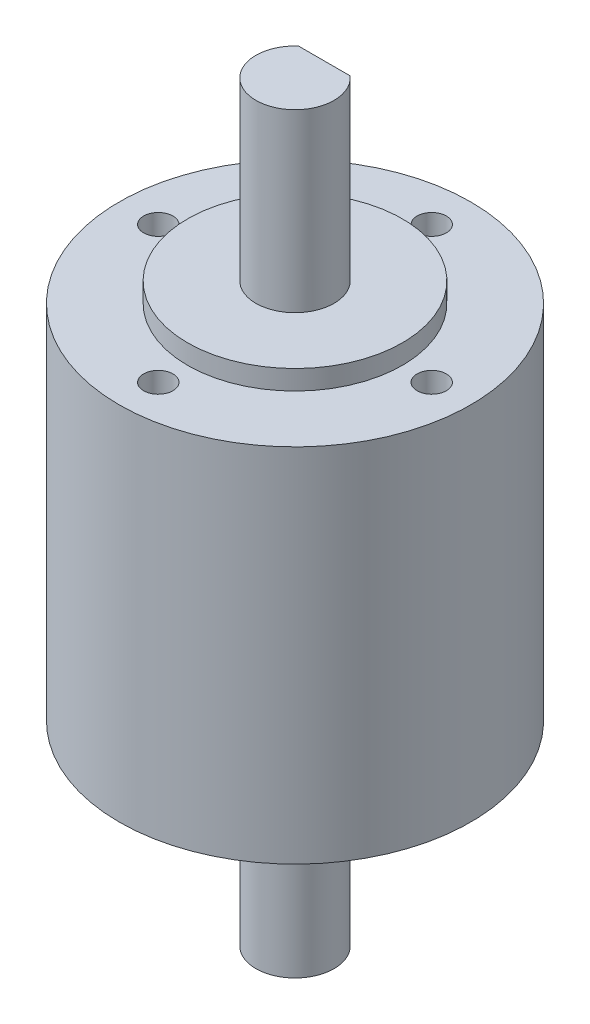
from build123d import *

# Parameters (mm, degrees)
SKETCH1_R           = 18
BOSS_EXTRUDE1_DEPTH = 18.5
SKETCH2_R           = 11
BOSS_EXTRUDE2_DEPTH = 2
SKETCH3_R           = 4
BOSS_EXTRUDE4_DEPTH = 18
CUT_EXTRUDE1_START  = -15
CUT_EXTRUDE1_DEPTH  = 15
SKETCH5_R           = 1.5
CUT_EXTRUDE2_DEPTH  = 4


with BuildPart() as part:
    # Sketch1 → Boss-Extrude1 (new, symmetric)
    with BuildSketch(Plane(origin=(0, 0, 0), x_dir=(1, 0, 0), z_dir=(0, 1, 0))):
        Circle(SKETCH1_R)
    extrude(amount=BOSS_EXTRUDE1_DEPTH, both=True)

    # Sketch2 → Boss-Extrude2 (add)
    with BuildSketch(Plane(origin=(0, 18.5, 0), x_dir=(1, 0, 0), z_dir=(0, 1, 0))):
        Circle(SKETCH2_R)
    boss_extrude2 = extrude(amount=BOSS_EXTRUDE2_DEPTH)

    # Sketch3 → Boss-Extrude4 (add)
    with BuildSketch(Plane(origin=(0, 20.5, 0), x_dir=(1, 0, 0), z_dir=(0, 1, 0))):
        Circle(SKETCH3_R)
    boss_extrude4 = extrude(amount=BOSS_EXTRUDE4_DEPTH)

    # Sketch4 → Cut-Extrude1 (cut)
    with BuildSketch(Plane(origin=(0, 38.5, 0), x_dir=(1, 0, 0), z_dir=(0, 1, 0)).offset(CUT_EXTRUDE1_START)):
        with BuildLine():
            Line((-2.645751311, 3), (2.645751311, 3))
            ThreePointArc((2.645751311, 3), (0, 4), (-2.645751311, 3))
        make_face()
    cut_extrude1 = extrude(amount=CUT_EXTRUDE1_DEPTH, mode=Mode.SUBTRACT)

    # Sketch5 → Cut-Extrude2 (cut)
    with BuildSketch(Plane(origin=(0, 18.5, 0), x_dir=(1, 0, 0), z_dir=(0, 1, 0))):
        with Locations((0, 14)):
            Circle(SKETCH5_R)
        with Locations((-14, 0)):
            Circle(SKETCH5_R)
        with Locations((0, -14)):
            Circle(SKETCH5_R)
        with Locations((14, 0)):
            Circle(SKETCH5_R)
    cut_extrude2 = extrude(amount=-CUT_EXTRUDE2_DEPTH, mode=Mode.SUBTRACT)

    # Mirror1: Boss-Extrude2, Boss-Extrude4, Cut-Extrude1, Cut-Extrude2 across plane
    add(boss_extrude2.mirror(Plane.ZX))
    add(boss_extrude4.mirror(Plane.ZX))
    add(cut_extrude1.mirror(Plane.ZX), mode=Mode.SUBTRACT)
    add(cut_extrude2.mirror(Plane.ZX), mode=Mode.SUBTRACT)


solid = part.part
